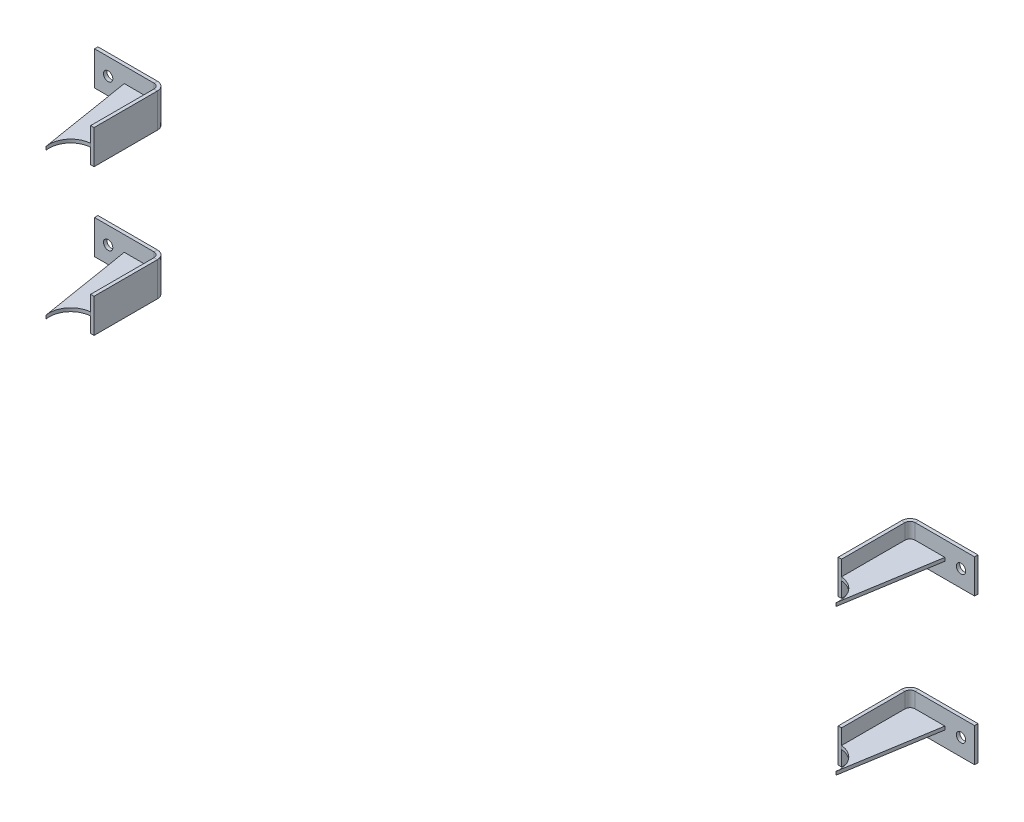
from build123d import *

# Parameters (mm, degrees)
SKETCH3_W                = 50
SKETCH3_H                = 20
BASE_FLANGE1_DEPTH       = 2
EDGE_FLANGE1_DEPTH       = 20
BOSS_EXTRUDE2_DEPTH      = 1
SKETCH19_R               = 2.75
CUT_EXTRUDE1_DEPTH       = 48
INDENT1_START            = 185
INDENT1_DEPTH            = 20
BODY_DELETE_KEEP_START   = 185
BODY_DELETE_KEEP_1_DEPTH = 20
LPATTERN1_COUNT          = 2
LPATTERN1_PITCH          = 86


# Read off the part's stored shape, not the designer's step: Indent1, Body-Delete/Keep 1
# Sheet-metal steps are written as plain solids
with BuildPart() as part:
    # Sketch3 → Base-Flange1 (new body)
    with BuildSketch(Plane(origin=(221, 0, 0), x_dir=(0, 0, -1), z_dir=(1, 0, 0))):
        with Locations((2275, 195)):
            Rectangle(SKETCH3_W, SKETCH3_H)
    extrude(amount=-BASE_FLANGE1_DEPTH)

    # Edge-Flange1 section (across the edge) → Edge-Flange1 (add)
    with BuildSketch(Plane(origin=(221, 185, -2303), x_dir=(0, 0, 1), z_dir=(0, 1, 0))):
        with BuildLine():
            Line((-2, 3), (-2, 38))
            Line((-2, 38), (0, 38))
            Line((0, 38), (0, 3))
            ThreePointArc((0, 3), (0.878679656, 0.878679656), (3, 0))
            Line((3, 0), (3, -2))
            ThreePointArc((3, -2), (-0.535533906, -0.535533906), (-2, 3))
        make_face()
    extrude(amount=EDGE_FLANGE1_DEPTH)

    # Sketch19 → Cut-Extrude1 (cut)
    with BuildSketch(Plane.XY.offset(-2303)):
        with Locations((251, 195)):
            Circle(SKETCH19_R)
    extrude(amount=-CUT_EXTRUDE1_DEPTH, mode=Mode.SUBTRACT)

    # Indent1 outline → Indent1 (cut)
    with BuildSketch(Plane(origin=(0, 0, 0), x_dir=(1, 0, 0), z_dir=(0, 1, 0)).offset(INDENT1_START)):
        with BuildLine():
            Line((221, 2261.356055653), (221, 2262.660568708))
            ThreePointArc((221, 2262.660568708), (220, 2262.7), (219, 2262.660568708))
            Line((219, 2262.660568708), (219, 2261.356055653))
            ThreePointArc((219, 2261.356055653), (220, 2261.4), (221, 2261.356055653))
        make_face()
    extrude(amount=INDENT1_DEPTH, mode=Mode.SUBTRACT)

    # Body-Delete/Keep 1 outline → Body-Delete/Keep 1 (cut)
    with BuildSketch(Plane(origin=(0, 0, 0), x_dir=(1, 0, 0), z_dir=(0, 1, 0)).offset(BODY_DELETE_KEEP_START)):
        with BuildLine():
            ThreePointArc((221, 2261.356055653), (220, 2261.4), (219, 2261.356055653))
            Line((219, 2261.356055653), (219, 2250))
            Line((219, 2250), (221, 2250))
            Line((221, 2250), (221, 2261.356055653))
        make_face()
    extrude(amount=BODY_DELETE_KEEP_1_DEPTH, mode=Mode.SUBTRACT)


with BuildPart() as body_2:
    # Sketch11 → Boss-Extrude2 (new, symmetric)
    with BuildSketch(Plane(origin=(0, 195, 0), x_dir=(1, 0, 0), z_dir=(0, 1, 0))):
        with BuildLine():
            Line((221, 2300), (221, 2262.660568708))
            ThreePointArc((221, 2262.660568708), (229.991834673, 2257.839211686), (232.534814834, 2247.958329831))
            Line((232.534814834, 2247.958329831), (241.5, 2303))
            Line((241.5, 2303), (224, 2303))
            ThreePointArc((224, 2303), (221.878679656, 2302.121320344), (221, 2300))
        make_face()
    extrude(amount=BOSS_EXTRUDE2_DEPTH, both=True)


with BuildPart() as lpattern1_1:
    # LPattern1: pattern copy
    add(part.part.moved(Location(Vector(0, -1, 0) * (1 * LPATTERN1_PITCH))))


with BuildPart() as lpattern1_2:
    # LPattern1: pattern copy
    add(body_2.part.moved(Location(Vector(0, -1, 0) * (1 * LPATTERN1_PITCH))))


with BuildPart() as body_5:
    # Mirror1: mirrored copy
    add(part.part.mirror(Plane(origin=(0, 0, 0), x_dir=(0, 0, 1), z_dir=(1, 0, 0))))


with BuildPart() as body_6:
    # Mirror1 2: mirrored copy
    add(body_2.part.mirror(Plane(origin=(0, 0, 0), x_dir=(0, 0, 1), z_dir=(1, 0, 0))))


with BuildPart() as body_7:
    # Mirror1 3: mirrored copy
    add(lpattern1_1.part.mirror(Plane(origin=(0, 0, 0), x_dir=(0, 0, 1), z_dir=(1, 0, 0))))


with BuildPart() as body_8:
    # Mirror1 4: mirrored copy
    add(lpattern1_2.part.mirror(Plane(origin=(0, 0, 0), x_dir=(0, 0, 1), z_dir=(1, 0, 0))))


solid = Compound([part.part, body_2.part, lpattern1_1.part, lpattern1_2.part, body_5.part, body_6.part, body_7.part, body_8.part])
